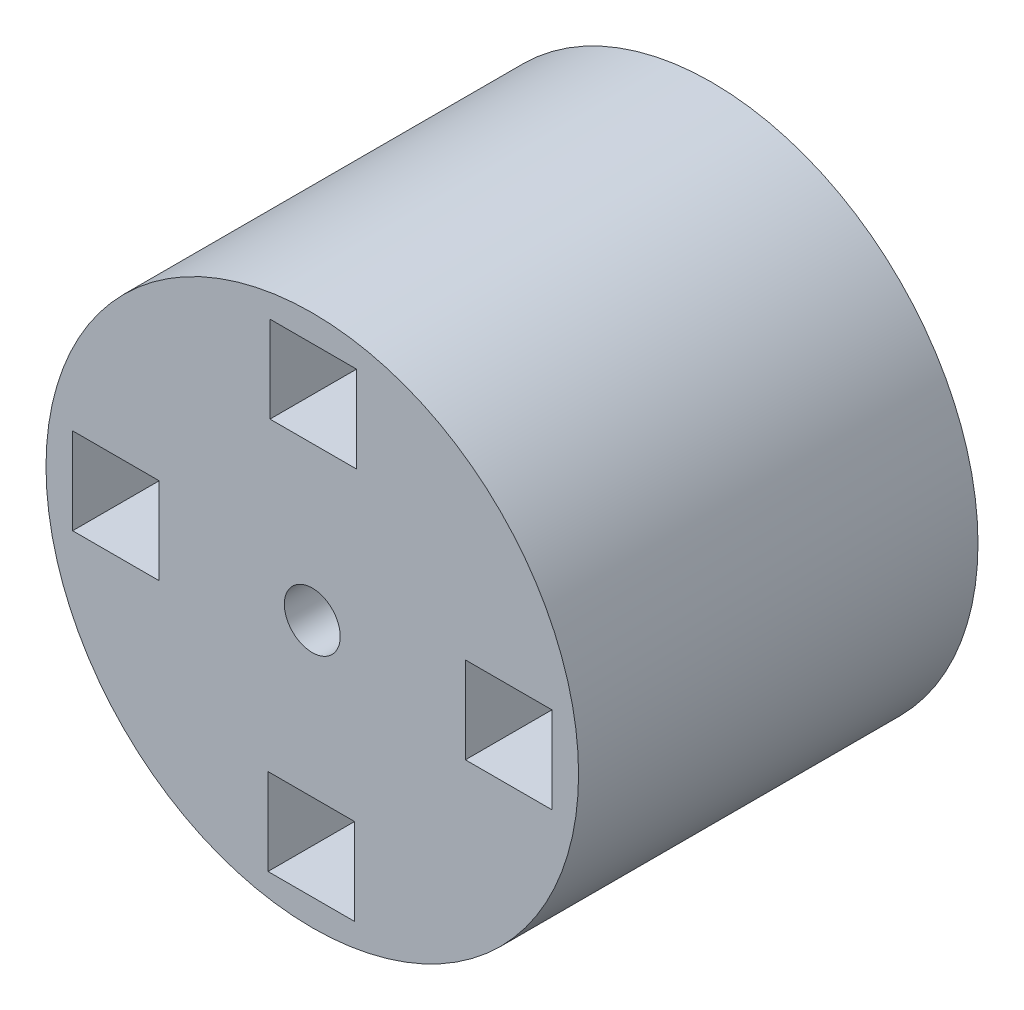
from build123d import *

# Parameters (mm, degrees)
SKETCH1_R                       = 20
SKETCH1_R_2                     = 1
BOSS_EXTRUDE1_DEPTH             = 30
TAP_DRILL_FOR_M5X0_8_TAP1_D     = 4.2
TAP_DRILL_FOR_M5X0_8_TAP1_DEPTH = 5
TAP_DRILL_FOR_M5X0_8_TAP1_TIP   = 1.2618073
SKETCH4_W                       = 6.5
SKETCH4_H                       = 6.5
CUT_EXTRUDE1_DEPTH              = 27.5
CIRPATTERN1_COUNT               = 4
SKETCH5_R                       = 6.5
SKETCH5_R_2                     = 5.5
CUT_EXTRUDE2_DEPTH              = 1
FILLET3_R                       = 0.5


with BuildPart() as part:
    # Sketch1 → Boss-Extrude1 (new body)
    with BuildSketch(Plane.XY):
        with Locations((-11.822558412, 14.529752947)):
            Circle(SKETCH1_R)
        with Locations((-11.822558412, 14.529752947)):
            Circle(SKETCH1_R_2, mode=Mode.SUBTRACT)
    extrude(amount=BOSS_EXTRUDE1_DEPTH)

    # Tap Drill for M5x0.8 Tap1
    with Locations(Plane.XY.offset(30)):
        with Locations((-11.822558412, 14.529752947)):
            Hole(TAP_DRILL_FOR_M5X0_8_TAP1_D / 2, depth=TAP_DRILL_FOR_M5X0_8_TAP1_DEPTH)
            with Locations((0, 0, -(TAP_DRILL_FOR_M5X0_8_TAP1_DEPTH + TAP_DRILL_FOR_M5X0_8_TAP1_TIP / 2))):  # 118° drill point
                Cone(0, TAP_DRILL_FOR_M5X0_8_TAP1_D / 2, TAP_DRILL_FOR_M5X0_8_TAP1_TIP, mode=Mode.SUBTRACT)

    # Sketch4 → Cut-Extrude1 (cut)
    with BuildSketch(Plane.XY.offset(30)):
        with Locations((2.927441588, 14.454752947)):
            Rectangle(SKETCH4_W, SKETCH4_H)
    cut_extrude1 = extrude(amount=-CUT_EXTRUDE1_DEPTH, mode=Mode.SUBTRACT)

    # CirPattern1: Cut-Extrude1 ×4 about axis
    cirpattern1_axis = Axis((-11.822558412, 14.529752947, 0), (0, 0, 1))
    for i in range(1, CIRPATTERN1_COUNT):
        add(cut_extrude1.rotate(cirpattern1_axis, i * 360 / CIRPATTERN1_COUNT), mode=Mode.SUBTRACT)

    # Sketch5 → Cut-Extrude2 (cut)
    with BuildSketch(Plane(origin=(0, 0, 0), x_dir=(-1, 0, 0), z_dir=(0, 0, -1))):
        with Locations((11.822558412, 14.529752947)):
            Circle(SKETCH5_R)
        with Locations((11.822558412, 14.529752947)):
            Circle(SKETCH5_R_2, mode=Mode.SUBTRACT)
    extrude(amount=-CUT_EXTRUDE2_DEPTH, mode=Mode.SUBTRACT)

    # Fillet3
    fillet3_edges = [part.edges().sort_by_distance(p)[0] for p in [
        (-5.322558412, 14.529752947, 1),
        (-6.322558412, 14.529752947, 1),
    ]]
    fillet(fillet3_edges, radius=FILLET3_R - 0.0001)  # a hair under: the kernel refuses the full size


solid = part.part
